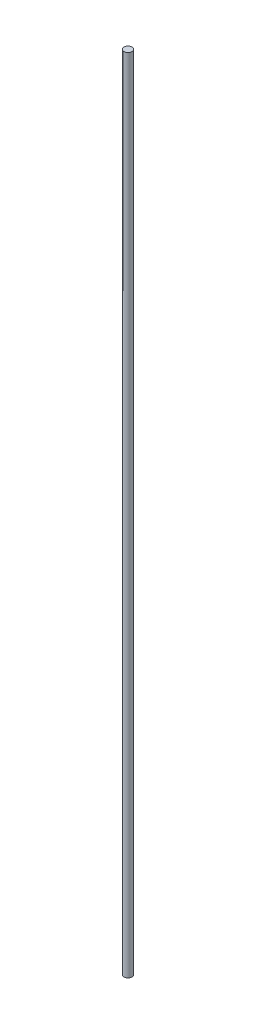
from build123d import *

# Parameters (mm, degrees)
SKETCH1_R           = 5
BOSS_EXTRUDE1_DEPTH = 1000


with BuildPart() as part:
    # Sketch1 → Boss-Extrude1 (new body)
    with BuildSketch(Plane(origin=(0, 0, 0), x_dir=(1, 0, 0), z_dir=(0, 1, 0))):
        Circle(SKETCH1_R)
    extrude(amount=BOSS_EXTRUDE1_DEPTH)


solid = part.part
